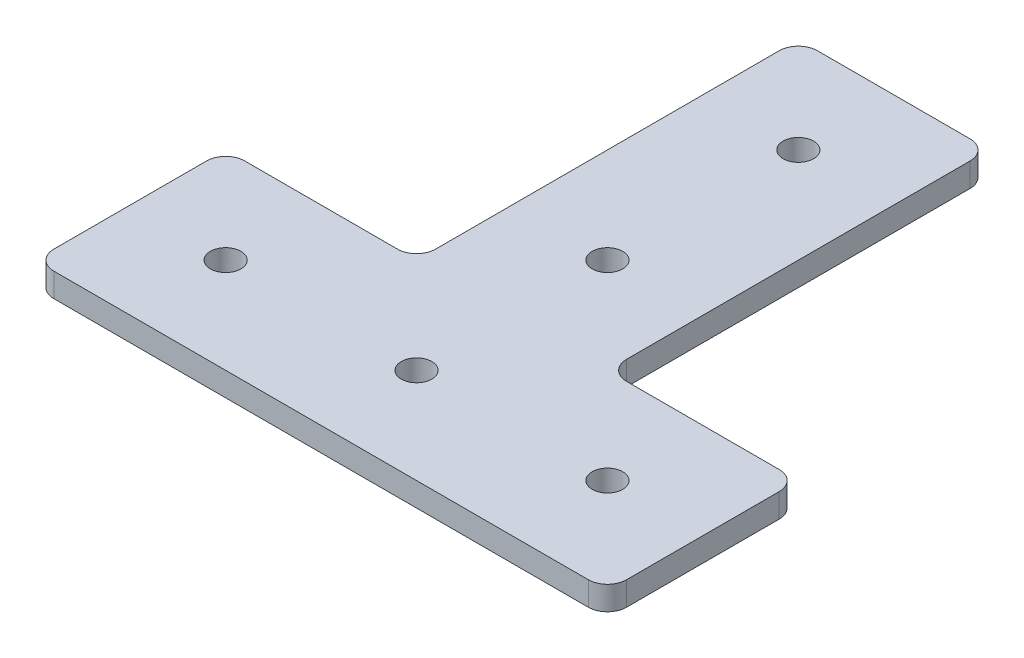
from build123d import *

# Parameters (mm, degrees)
SKETCH1_R           = 2.032
BOSS_EXTRUDE1_DEPTH = 3.175


with BuildPart() as part:
    # Sketch1 → Boss-Extrude1 (new body)
    with BuildSketch(Plane(origin=(0, 0, 0), x_dir=(1, 0, 0), z_dir=(0, 1, 0))):
        with BuildLine():
            Line((18.720543933, 17.495711297), (39.040543933, 17.495711297))
            ThreePointArc((39.040543933, 17.495711297), (40.836595157, 16.751762521), (41.580543933, 14.955711297))
            Line((41.580543933, 14.955711297), (41.580543933, -5.364288703))
            ThreePointArc((41.580543933, -5.364288703), (40.836595157, -7.160339927), (39.040543933, -7.904288703))
            Line((39.040543933, -7.904288703), (-32.079456067, -7.904288703))
            ThreePointArc((-32.079456067, -7.904288703), (-33.875507291, -7.160339927), (-34.619456067, -5.364288703))
            Line((-34.619456067, -5.364288703), (-34.619456067, 14.955711297))
            ThreePointArc((-34.619456067, 14.955711297), (-33.875507291, 16.751762521), (-32.079456067, 17.495711297))
            Line((-32.079456067, 17.495711297), (-11.759456067, 17.495711297))
            ThreePointArc((-11.759456067, 17.495711297), (-9.963404843, 18.239660073), (-9.219456067, 20.035711297))
            Line((-9.219456067, 20.035711297), (-9.219456067, 65.755711297))
            ThreePointArc((-9.219456067, 65.755711297), (-8.475507291, 67.551762521), (-6.679456067, 68.295711297))
            Line((-6.679456067, 68.295711297), (13.640543933, 68.295711297))
            ThreePointArc((13.640543933, 68.295711297), (15.436595157, 67.551762521), (16.180543933, 65.755711297))
            Line((16.180543933, 65.755711297), (16.180543933, 20.035711297))
            ThreePointArc((16.180543933, 20.035711297), (16.924492709, 18.239660073), (18.720543933, 17.495711297))
        make_face()
        with Locations((3.480543933, 4.795711297)):
            Circle(SKETCH1_R, mode=Mode.SUBTRACT)
        with Locations((-21.919456067, 4.795711297)):
            Circle(SKETCH1_R, mode=Mode.SUBTRACT)
        with Locations((28.880543933, 4.795711297)):
            Circle(SKETCH1_R, mode=Mode.SUBTRACT)
        with Locations((3.480543933, 30.195711297)):
            Circle(SKETCH1_R, mode=Mode.SUBTRACT)
        with Locations((3.480543933, 55.595711297)):
            Circle(SKETCH1_R, mode=Mode.SUBTRACT)
    extrude(amount=BOSS_EXTRUDE1_DEPTH)


solid = part.part
